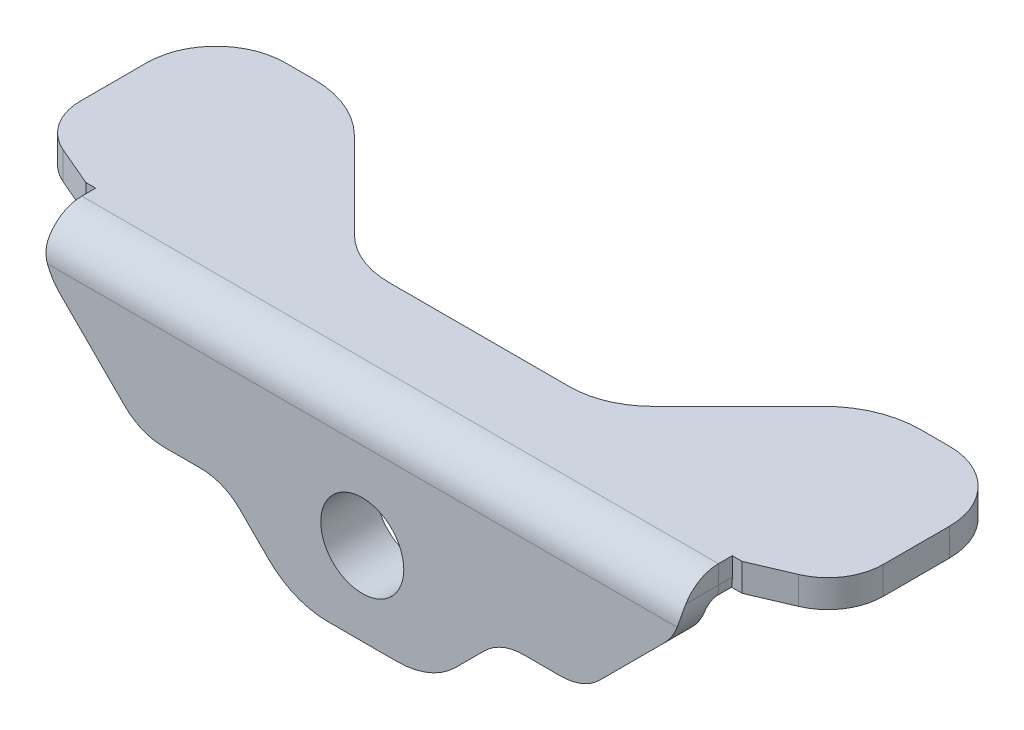
from build123d import *

# Parameters (mm, degrees)
BASE_FLANGE1_DEPTH   = 2
EDGE_FLANGE1_START   = -23
EDGE_FLANGE1_DEPTH   = 46
EDGE_FLANGE1_START_2 = -23.714787909
EDGE_FLANGE1_2_DEPTH = 0.714787909
EDGE_FLANGE1_START_3 = 23
EDGE_FLANGE1_3_DEPTH = 0.714787909
EDGE_FLANGE1_4_DEPTH = 46
CUT_EXTRUDE1_DEPTH   = 10
FILLET1_R            = 4
FILLET2_R            = 6
SKETCH9_R            = 3
CUT_EXTRUDE2_DEPTH   = 10
SKETCH10_R           = 3
BOSS_EXTRUDE1_DEPTH  = 2
SCALE1_SCALE         = 0.7761


# Read off the part's stored shape, not the designer's step: Edge-Flange1
# Sheet-metal steps are written as plain solids
with BuildPart() as part:
    # Sketch1 → Base-Flange1 (new body)
    with BuildSketch(Plane(origin=(0, 0, 0), x_dir=(1, 0, 0), z_dir=(0, 1, 0))):
        with BuildLine():
            Line((-16.949747468, 6.379735664), (-9, -1.570011804))
            Line((-9, -1.570011804), (9, -1.570011804))
            Line((9, -1.570011804), (16.949747468, 6.379735664))
            ThreePointArc((16.949747468, 6.379735664), (19.22071091, 7.897144924), (21.899494937, 8.429988196))
            Line((21.899494937, 8.429988196), (24, 8.429988196))
            ThreePointArc((24, 8.429988196), (27.535533906, 6.965522102), (29, 3.429988196))
            Line((29, 3.429988196), (29, -1.361639596))
            ThreePointArc((29, -1.361639596), (28.339066725, -3.564054954), (26.574683296, -5.038645514))
            Line((26.574683296, -5.038645514), (23, -6.569508994))
            Line((23, -6.569508994), (23, -10))
            Line((23, -10), (-23, -10))
            Line((-23, -10), (-23, -6.569508994))
            Line((-23, -6.569508994), (-26.574683296, -5.038645514))
            ThreePointArc((-26.574683296, -5.038645514), (-28.339066725, -3.564054954), (-29, -1.361639596))
            Line((-29, -1.361639596), (-29, 3.429988196))
            ThreePointArc((-29, 3.429988196), (-27.535533906, 6.965522102), (-24, 8.429988196))
            Line((-24, 8.429988196), (-21.899494937, 8.429988196))
            ThreePointArc((-21.899494937, 8.429988196), (-19.22071091, 7.897144924), (-16.949747468, 6.379735664))
        make_face()
    extrude(amount=-BASE_FLANGE1_DEPTH)

    # Edge-Flange1 outline → Edge-Flange1 (cut)
    with BuildSketch(Plane.YZ.offset(EDGE_FLANGE1_START)):
        with BuildLine():
            ThreePointArc((-2, 9.899002398), (-0.556604688, 8.917667209), (0, 7.2634))
            Line((0, 7.2634), (0, 10))
            Line((0, 10), (-2, 10))
            Line((-2, 10), (-2, 9.899002398))
        make_face()
    extrude(amount=EDGE_FLANGE1_DEPTH, mode=Mode.SUBTRACT)

    # Edge-Flange1 2 outline → Edge-Flange1 2 (cut)
    with BuildSketch(Plane.YZ.offset(EDGE_FLANGE1_START_2)):
        with BuildLine():
            Line((-2, 6.2634), (0, 6.2634))
            Line((0, 6.2634), (0, 7.2634))
            ThreePointArc((0, 7.2634), (-0.556604688, 8.917667209), (-2, 9.899002398))
            Line((-2, 9.899002398), (-2, 6.2634))
        make_face()
    extrude(amount=EDGE_FLANGE1_2_DEPTH, mode=Mode.SUBTRACT)

    # Edge-Flange1 3 outline → Edge-Flange1 3 (cut)
    with BuildSketch(Plane.YZ.offset(EDGE_FLANGE1_START_3)):
        with BuildLine():
            Line((-2, 6.2634), (0, 6.2634))
            Line((0, 6.2634), (0, 7.2634))
            ThreePointArc((0, 7.2634), (-0.556604688, 8.917667209), (-2, 9.899002398))
            Line((-2, 9.899002398), (-2, 6.2634))
        make_face()
    extrude(amount=EDGE_FLANGE1_3_DEPTH, mode=Mode.SUBTRACT)

    # Edge-Flange1 4 outline → Edge-Flange1 4 (add)
    with BuildSketch(Plane.YZ.offset(EDGE_FLANGE1_START)):
        with BuildLine():
            ThreePointArc((-2.7366, 8), (-2.215745145, 7.784254855), (-2, 7.2634))
            Line((-2, 7.2634), (-2, 9.899002398))
            ThreePointArc((-2, 9.899002398), (-2.364854094, 9.974633029), (-2.7366, 10))
            Line((-2.7366, 10), (-15, 10))
            Line((-15, 10), (-15, 8))
            Line((-15, 8), (-2.7366, 8))
        make_face()
    extrude(amount=EDGE_FLANGE1_4_DEPTH)

    # Sketch8 → Cut-Extrude1 (cut)
    with BuildSketch(Plane.XY.offset(10)):
        Polygon((-16, -10), (-23, -3), (-23, -15), (-5, -15), (-10, -10), align=None)
        Polygon((10, -10), (5, -15), (23, -15), (23, -3), (16, -10), align=None)
    extrude(amount=-CUT_EXTRUDE1_DEPTH, mode=Mode.SUBTRACT)

    # Fillet1
    fillet1_edges = [part.edges().sort_by_distance(p)[0] for p in [
        (-23, -3, 9),
        (-16, -10, 9),
        (-10, -10, 9),
        (10, -10, 9),
        (16, -10, 9),
        (23, -3, 9),
    ]]
    fillet(fillet1_edges, radius=FILLET1_R)

    # Fillet2
    fillet2_edges = [part.edges().sort_by_distance(p)[0] for p in [
        (-5, -15, 9),
        (5, -15, 9),
        (9, -1, 1.570011804),
        (-9, -1, 1.570011804),
    ]]
    fillet(fillet2_edges, radius=FILLET2_R)

    # Sketch9 → Cut-Extrude2 (cut)
    with BuildSketch(Plane.XY.offset(10)):
        with Locations((0, -9)):
            Circle(SKETCH9_R)
    extrude(amount=-CUT_EXTRUDE2_DEPTH, mode=Mode.SUBTRACT)

    # Sketch10 → Boss-Extrude1 (add)
    with BuildSketch(Plane(origin=(0, 0, 8), x_dir=(-1, 0, 0), z_dir=(0, 0, -1))):
        Polygon((5.42709253, -9), (2.713546265, -4.3), (-2.713546265, -4.3), (-5.42709253, -9), (-2.713546265, -13.7), (2.713546265, -13.7), align=None)
        with Locations(Location((0, -9, 0), (0, 0, 180))):
            Circle(SKETCH10_R, mode=Mode.SUBTRACT)
    extrude(amount=BOSS_EXTRUDE1_DEPTH)


with BuildPart() as part_1:
    # Scale1: scaled about (0, -3.290648573, 4.477741927)
    add(part.part.scale(SCALE1_SCALE).moved(Location((0, -0.736776215, 1.002566417))))


solid = part_1.part
